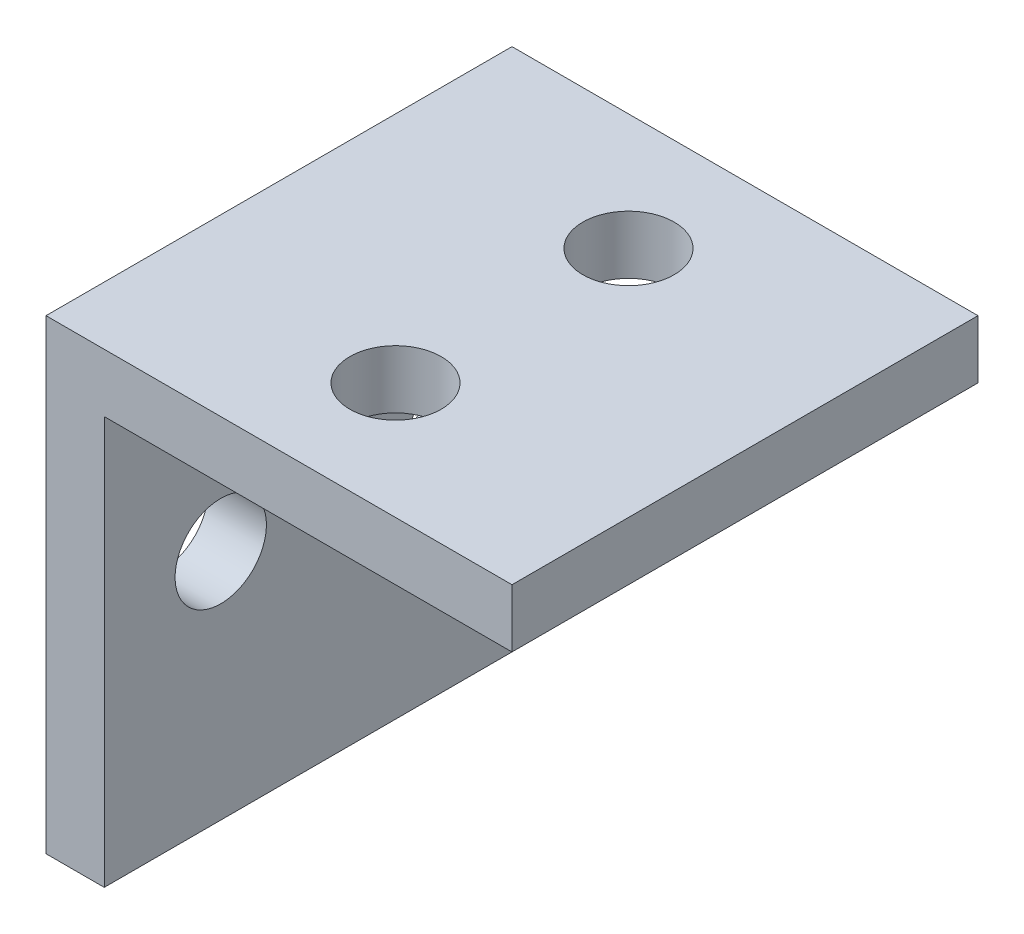
from build123d import *

# Parameters (mm, degrees)
BOSS_EXTRUDE1_DEPTH = 25.4
SKETCH5_R           = 2.4892
CUT_EXTRUDE1_DEPTH  = 43.240627659
SKETCH6_R           = 2.4892
CUT_EXTRUDE2_DEPTH  = 43.240627659


with BuildPart() as part:
    # Sketch2 → Boss-Extrude1 (new body)
    with BuildSketch(Plane.XY):
        Polygon((0, 0), (0, -25.4), (3.175, -25.4), (3.175, -3.175), (25.4, -3.175), (25.4, 0), align=None)
    extrude(amount=BOSS_EXTRUDE1_DEPTH)

    # Sketch5 → Cut-Extrude1 (cut, through all)
    with BuildSketch(Plane(origin=(3.175, 0, 0), x_dir=(0, 0, -1), z_dir=(1, 0, 0))):
        with Locations((-6.35, -12.7)):
            Circle(SKETCH5_R)
        with Locations((-19.05, -12.7)):
            Circle(SKETCH5_R)
        with Locations((-31.75, -12.7)):
            Circle(SKETCH5_R)
        with Locations((-44.45, -12.7)):
            Circle(SKETCH5_R)
    extrude(amount=-CUT_EXTRUDE1_DEPTH, mode=Mode.SUBTRACT)

    # Sketch6 → Cut-Extrude2 (cut, through all)
    with BuildSketch(Plane.XZ.offset(3.175)):
        with Locations((12.7, 6.35)):
            Circle(SKETCH6_R)
        with Locations((12.7, 19.05)):
            Circle(SKETCH6_R)
        with Locations((12.7, 31.75)):
            Circle(SKETCH6_R)
        with Locations((12.7, 44.45)):
            Circle(SKETCH6_R)
    extrude(amount=-CUT_EXTRUDE2_DEPTH, mode=Mode.SUBTRACT)


solid = part.part
